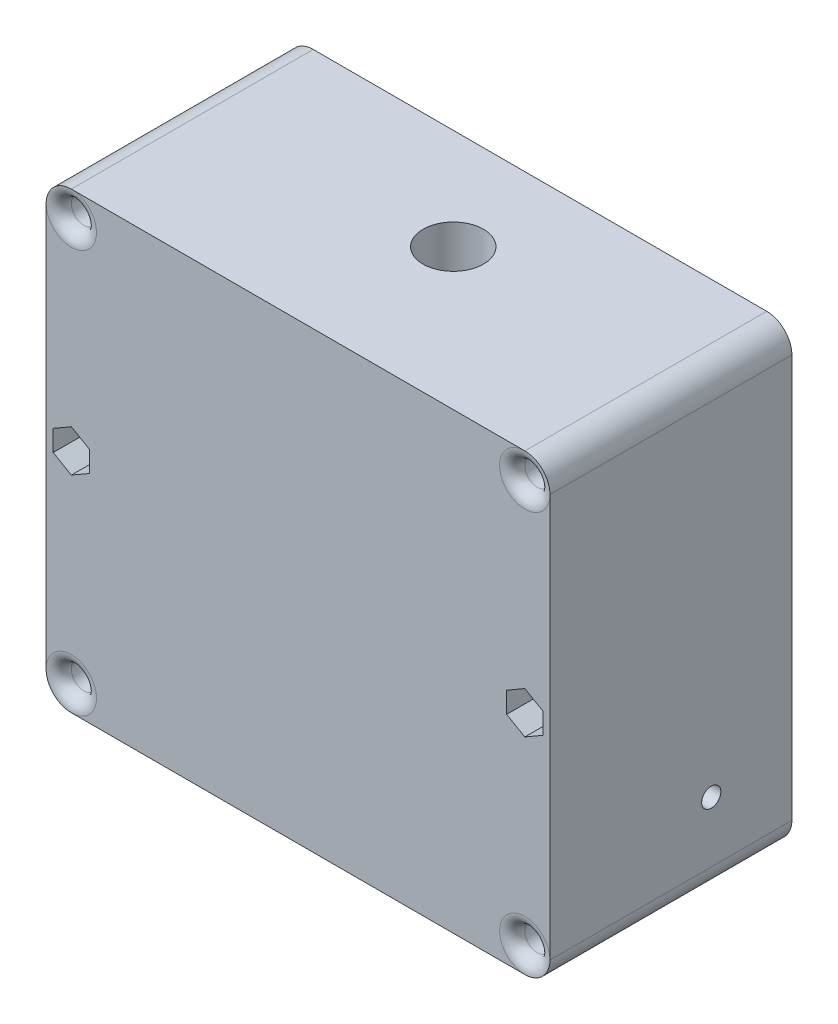
from build123d import *

# Parameters (mm, degrees)
SKETCH2_W           = 127
SKETCH2_H           = 114.3
SKETCH2_R           = 3.175
SKETCH2_R_2         = 2.54
BOSS_EXTRUDE2_DEPTH = 3.81
FILLET1_R           = 3.175
BOSS_EXTRUDE3_START = -57.15
SKETCH2_4_W         = 127
SKETCH2_4_H         = 114.3
SKETCH2_4_R         = 3.175
SKETCH2_4_R_2       = 2.54
SKETCH2_4_W_2       = 101.6
SKETCH2_4_H_2       = 88.9
BOSS_EXTRUDE3_DEPTH = 57.15
FILLET3_R           = 6.35
SKETCH3_W           = 3.175
SKETCH3_H           = 31.75
BOSS_EXTRUDE4_DEPTH = 7.62
SKETCH4_W           = 12.7
SKETCH4_H           = 3.175
BOSS_EXTRUDE5_DEPTH = 10.16
SKETCH5_W           = 3.175
SKETCH5_H           = 66.675
BOSS_EXTRUDE6_DEPTH = 45.72
CUT_EXTRUDE1_START  = -10.16
SKETCH6_R           = 4.572
SKETCH6_R_2         = 2.54
CUT_EXTRUDE1_DEPTH  = 10.16
SKETCH7_R           = 7.62
CUT_EXTRUDE2_DEPTH  = 15.24
SKETCH8_R           = 2.413
CUT_EXTRUDE3_DEPTH  = 15.24


with BuildPart() as part:
    # Sketch2 → Boss-Extrude2 (new body)
    with BuildSketch(Plane.XY):
        with Locations((63.5, 57.15)):
            Rectangle(SKETCH2_W, SKETCH2_H)
        with Locations(Location((6.35, 107.95, 0), (0, 0, 180))):
            Circle(SKETCH2_R, mode=Mode.SUBTRACT)
        with Locations(Location((120.65, 107.95, 0), (0, 0, 180))):
            Circle(SKETCH2_R, mode=Mode.SUBTRACT)
        with Locations(Location((120.65, 6.35, 0), (0, 0, 180))):
            Circle(SKETCH2_R, mode=Mode.SUBTRACT)
        with Locations(Location((6.35, 6.35, 0), (0, 0, 180))):
            Circle(SKETCH2_R, mode=Mode.SUBTRACT)
        with Locations(Location((6.35, 57.15, 0), (0, 0, 180))):
            Circle(SKETCH2_R_2, mode=Mode.SUBTRACT)
        with Locations(Location((120.65, 57.15, 0), (0, 0, 180))):
            Circle(SKETCH2_R_2, mode=Mode.SUBTRACT)
    extrude(amount=BOSS_EXTRUDE2_DEPTH)

    # Fillet1
    fillet1_edges = [part.edges().sort_by_distance(p)[0] for p in [
        (123.825, 107.95, 3.81),
        (9.525, 107.95, 3.81),
        (9.525, 6.35, 3.81),
        (123.825, 6.35, 3.81),
    ]]
    fillet(fillet1_edges, radius=FILLET1_R - 0.0001)  # a hair under: the kernel refuses the full size

    # Sketch2<4> → Boss-Extrude3 (add)
    with BuildSketch(Plane.XY.offset(BOSS_EXTRUDE3_START)):
        with Locations((63.5, 57.15)):
            Rectangle(SKETCH2_4_W, SKETCH2_4_H)
        with Locations(Location((6.35, 107.95, 0), (0, 0, 180))):
            Circle(SKETCH2_4_R, mode=Mode.SUBTRACT)
        with Locations(Location((120.65, 107.95, 0), (0, 0, 180))):
            Circle(SKETCH2_4_R, mode=Mode.SUBTRACT)
        with Locations(Location((120.65, 6.35, 0), (0, 0, 180))):
            Circle(SKETCH2_4_R, mode=Mode.SUBTRACT)
        with Locations(Location((6.35, 6.35, 0), (0, 0, 180))):
            Circle(SKETCH2_4_R, mode=Mode.SUBTRACT)
        with Locations(Location((6.35, 57.15, 0), (0, 0, 180))):
            Circle(SKETCH2_4_R_2, mode=Mode.SUBTRACT)
        with Locations(Location((120.65, 57.15, 0), (0, 0, 180))):
            Circle(SKETCH2_4_R_2, mode=Mode.SUBTRACT)
        with Locations((63.5, 57.15)):
            Rectangle(SKETCH2_4_W_2, SKETCH2_4_H_2, mode=Mode.SUBTRACT)
    extrude(amount=BOSS_EXTRUDE3_DEPTH)

    # Fillet3
    fillet3_edges = [part.edges().sort_by_distance(p)[0] for p in [
        (0, 0, -26.67),
        (127, 0, -26.67),
        (127, 114.3, -26.67),
        (0, 114.3, -26.67),
    ]]
    fillet(fillet3_edges, radius=FILLET3_R)

    # Sketch3 → Boss-Extrude4 (add)
    with BuildSketch(Plane(origin=(0, 0, 0), x_dir=(-1, 0, 0), z_dir=(0, 0, -1))):
        Polygon((-101.6, 101.6), (-101.6, 38.1), (-114.3, 38.1), (-114.3, 34.925), (-101.6, 34.925), (-101.6, 12.7), (-98.425, 12.7), (-98.425, 94.742), (-46.863, 94.742), (-46.863, 69.85), (-43.688, 69.85), (-43.688, 101.6), align=None)
        with Locations((-45.2755, 28.575)):
            Rectangle(SKETCH3_W, SKETCH3_H)
    extrude(amount=BOSS_EXTRUDE4_DEPTH)

    # Sketch4 → Boss-Extrude5 (add)
    with BuildSketch(Plane(origin=(0, 0, -7.62), x_dir=(-1, 0, 0), z_dir=(0, 0, -1))):
        with Locations((-107.95, 36.5125)):
            Rectangle(SKETCH4_W, SKETCH4_H)
    extrude(amount=BOSS_EXTRUDE5_DEPTH)

    # Sketch5 → Boss-Extrude6 (add)
    with BuildSketch(Plane(origin=(0, 0, -7.62), x_dir=(-1, 0, 0), z_dir=(0, 0, -1))):
        with Locations((-100.0125, 68.2625)):
            Rectangle(SKETCH5_W, SKETCH5_H)
    extrude(amount=BOSS_EXTRUDE6_DEPTH)

    # Sketch6 → Cut-Extrude1 (cut)
    # profile 1 of 16: a face of its own
    with BuildSketch(Plane.XY.offset(3.81).offset(CUT_EXTRUDE1_START)):
        with BuildLine():
            Line((6.35, 62.429290861), (4.063999941, 61.109468112))
            ThreePointArc((4.063999941, 61.109468112), (6.349999924, 61.722), (8.635999927, 61.109468188))
            Line((8.635999927, 61.109468188), (6.35, 62.429290861))
        make_face()
    # profile 2 of 16: a face of its own
    with BuildSketch(Plane.XY.offset(3.81).offset(CUT_EXTRUDE1_START)):
        with BuildLine():
            Line((1.778, 59.789645431), (1.778, 57.15))
            ThreePointArc((1.778, 57.15), (2.390531837, 59.43599997), (4.063999941, 61.109468112))
            Line((4.063999941, 61.109468112), (1.778, 59.789645431))
        make_face()
    # profile 3 of 16: a face of its own
    with BuildSketch(Plane.XY.offset(3.81).offset(CUT_EXTRUDE1_START)):
        with BuildLine():
            Line((1.778, 57.15), (1.778, 54.510354569))
            Line((1.778, 54.510354569), (4.063999941, 53.190531888))
            ThreePointArc((4.063999941, 53.190531888), (2.390531837, 54.86400003), (1.778, 57.15))
        make_face()
    # profile 4 of 16: a face of its own
    with BuildSketch(Plane.XY.offset(3.81).offset(CUT_EXTRUDE1_START)):
        with BuildLine():
            ThreePointArc((8.636000059, 53.190531888), (6.35, 52.578), (4.063999941, 53.190531888))
            Line((4.063999941, 53.190531888), (6.35, 51.870709139))
            Line((6.35, 51.870709139), (8.636000059, 53.190531888))
        make_face()
    # profile 5 of 16: a face of its own
    with BuildSketch(Plane.XY.offset(3.81).offset(CUT_EXTRUDE1_START)):
        with BuildLine():
            ThreePointArc((10.922, 57.15), (10.309468163, 54.86400003), (8.636000059, 53.190531888))
            Line((8.636000059, 53.190531888), (10.922, 54.510354569))
            Line((10.922, 54.510354569), (10.922, 57.15))
        make_face()
    # profile 6 of 16: a face of its own
    with BuildSketch(Plane.XY.offset(3.81).offset(CUT_EXTRUDE1_START)):
        with BuildLine():
            Line((10.922, 59.789645431), (8.635999927, 61.109468188))
            ThreePointArc((8.635999927, 61.109468188), (10.309468125, 59.436000037), (10.922, 57.15))
            Line((10.922, 57.15), (10.922, 59.789645431))
        make_face()
    # profile 7 of 16: a face of its own
    with BuildSketch(Plane.XY.offset(3.81).offset(CUT_EXTRUDE1_START)):
        with Locations((6.35, 57.15)):
            Circle(SKETCH6_R)
        with Locations(Location((6.35, 57.15, 0), (0, 0, 180))):
            Circle(SKETCH6_R_2, mode=Mode.SUBTRACT)
    # profile 8 of 16: a face of its own
    with BuildSketch(Plane.XY.offset(3.81).offset(CUT_EXTRUDE1_START)):
        with Locations(Location((6.35, 57.15, 0), (0, 0, 180))):
            Circle(SKETCH6_R_2)
    # profile 9 of 16: a face of its own
    with BuildSketch(Plane.XY.offset(3.81).offset(CUT_EXTRUDE1_START)):
        with BuildLine():
            ThreePointArc((116.078, 57.15), (116.69053188, 59.436000046), (118.364000092, 61.109468199))
            Line((118.364000092, 61.109468199), (116.078, 59.789645431))
            Line((116.078, 59.789645431), (116.078, 57.15))
        make_face()
    # profile 10 of 16: a face of its own
    with BuildSketch(Plane.XY.offset(3.81).offset(CUT_EXTRUDE1_START)):
        with BuildLine():
            Line((116.078, 54.510354569), (118.363999941, 53.190531888))
            ThreePointArc((118.363999941, 53.190531888), (116.690531837, 54.86400003), (116.078, 57.15))
            Line((116.078, 57.15), (116.078, 54.510354569))
        make_face()
    # profile 11 of 16: a face of its own
    with BuildSketch(Plane.XY.offset(3.81).offset(CUT_EXTRUDE1_START)):
        with BuildLine():
            Line((120.65, 51.870709139), (122.935999915, 53.190531805))
            ThreePointArc((122.935999915, 53.190531805), (120.649999917, 52.578), (118.363999941, 53.190531888))
            Line((118.363999941, 53.190531888), (120.65, 51.870709139))
        make_face()
    # profile 12 of 16: a face of its own
    with BuildSketch(Plane.XY.offset(3.81).offset(CUT_EXTRUDE1_START)):
        with BuildLine():
            Line((122.935999915, 53.190531805), (125.222, 54.510354569))
            Line((125.222, 54.510354569), (125.222, 57.15))
            ThreePointArc((125.222, 57.15), (124.609468122, 54.863999958), (122.935999915, 53.190531805))
        make_face()
    # profile 13 of 16: a face of its own
    with BuildSketch(Plane.XY.offset(3.81).offset(CUT_EXTRUDE1_START)):
        with BuildLine():
            ThreePointArc((122.936000059, 61.109468112), (124.609468163, 59.43599997), (125.222, 57.15))
            Line((125.222, 57.15), (125.222, 59.789645431))
            Line((125.222, 59.789645431), (122.936000059, 61.109468112))
        make_face()
    # profile 14 of 16: a face of its own
    with BuildSketch(Plane.XY.offset(3.81).offset(CUT_EXTRUDE1_START)):
        with BuildLine():
            ThreePointArc((118.364000092, 61.109468199), (120.650000087, 61.722), (122.936000059, 61.109468112))
            Line((122.936000059, 61.109468112), (120.65, 62.429290861))
            Line((120.65, 62.429290861), (118.364000092, 61.109468199))
        make_face()
    # profile 15 of 16: a face of its own
    with BuildSketch(Plane.XY.offset(3.81).offset(CUT_EXTRUDE1_START)):
        with Locations((120.65, 57.15)):
            Circle(SKETCH6_R)
        with Locations(Location((120.65, 57.15, 0), (0, 0, 180))):
            Circle(SKETCH6_R_2, mode=Mode.SUBTRACT)
    # profile 16 of 16: a face of its own
    with BuildSketch(Plane.XY.offset(3.81).offset(CUT_EXTRUDE1_START)):
        with Locations(Location((120.65, 57.15, 0), (0, 0, 180))):
            Circle(SKETCH6_R_2)
    extrude(amount=CUT_EXTRUDE1_DEPTH, mode=Mode.SUBTRACT)

    # Sketch7 → Cut-Extrude2 (cut)
    with BuildSketch(Plane(origin=(0, 114.3, 0), x_dir=(1, 0, 0), z_dir=(0, 1, 0))):
        with Locations(Location((67.056, 31.75, 0), (0, 0, 270))):
            Circle(SKETCH7_R)
    extrude(amount=-CUT_EXTRUDE2_DEPTH, mode=Mode.SUBTRACT)

    # Sketch8 → Cut-Extrude3 (cut)
    with BuildSketch(Plane.ZY.offset(-114.3)):
        with Locations((-36.83, 21.59)):
            Circle(SKETCH8_R)
    extrude(amount=-CUT_EXTRUDE3_DEPTH, mode=Mode.SUBTRACT)


solid = part.part
